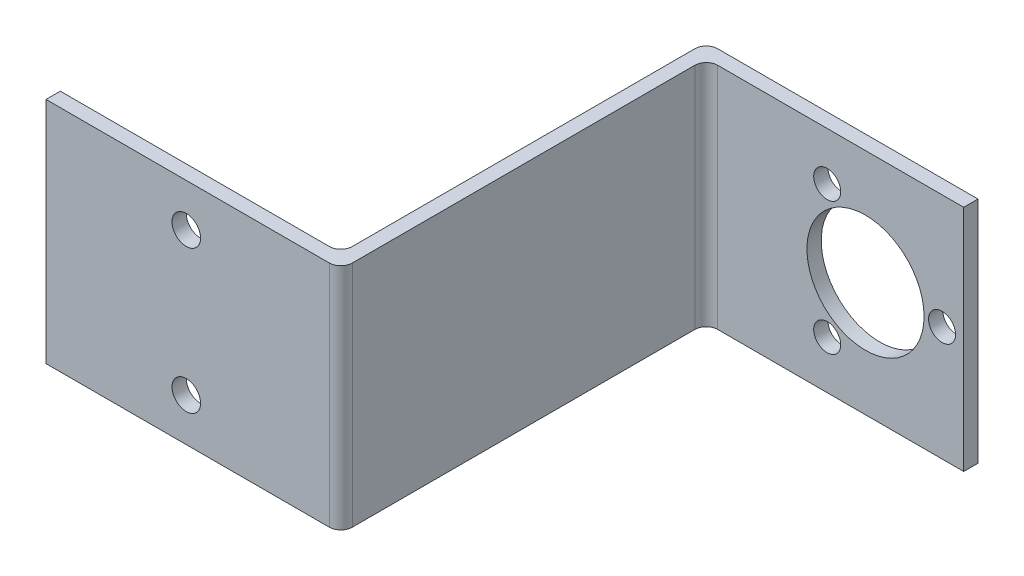
from build123d import *

# Parameters (mm, degrees)
BOSS_EXTRUDE2_DEPTH          = 25.4
CUT_EXTRUDE1_DEPTH           = 945.645794553
F_1_8_0_125_DIAMETER_HOLE1_D = 3.175
FILLET1_R                    = 1.27


with BuildPart() as part:
    # Sketch2 → Boss-Extrude2 (new body)
    with BuildSketch(Plane(origin=(0, 0, 0), x_dir=(1, 0, 0), z_dir=(0, 1, 0))):
        Polygon((-882.132668906, -41.925710249), (-912.295168906, -41.925710249), (-912.295168906, -82.488210249), (-943.432668907, -82.488210249), (-943.432668907, -84.075710249), (-910.707668906, -84.075710249), (-910.707668906, -43.513210249), (-882.132668906, -43.513210249), align=None)
    extrude(amount=BOSS_EXTRUDE2_DEPTH)

    # Sketch3 → Cut-Extrude1 (cut, through all)
    with BuildSketch(Plane.XY.offset(43.513210249)):
        with BuildLine():
            ThreePointArc((-886.032668907, 12.7), (-884.532668907, 11.2), (-883.032668907, 12.7))
            ThreePointArc((-883.032668907, 12.7), (-884.532668907, 14.2), (-886.032668907, 12.7))
        make_face()
        with BuildLine():
            ThreePointArc((-896.532668907, 18.762177827), (-895.983630801, 20.811215932), (-898.032668907, 21.360254038))
            ThreePointArc((-898.032668907, 21.360254038), (-898.581707013, 19.311215932), (-896.532668907, 18.762177827))
        make_face()
        with BuildLine():
            ThreePointArc((-898.032668907, 4.039745962), (-895.983630801, 4.588784068), (-896.532668907, 6.637822174))
            ThreePointArc((-896.532668907, 6.637822174), (-898.581707013, 6.088784068), (-898.032668907, 4.039745962))
        make_face()
        with BuildLine():
            ThreePointArc((-899.532668907, 12.7), (-893.032668907, 6.2), (-886.532668907, 12.7))
            ThreePointArc((-886.532668907, 12.7), (-893.032668907, 19.2), (-899.532668907, 12.7))
        make_face()
    extrude(amount=-CUT_EXTRUDE1_DEPTH, mode=Mode.SUBTRACT)

    # 1/8 (0.125) Diameter Hole1 (through all)
    with Locations(Plane(origin=(0, 0, 82.488210249), x_dir=(-1, 0, 0), z_dir=(0, 0, -1))):
        with Locations((927.863918906, 4.7625), (927.863918906, 20.6375)):
            Hole(F_1_8_0_125_DIAMETER_HOLE1_D / 2)

    # Fillet1
    fillet1_edges = [part.edges().sort_by_distance(p)[0] for p in [
        (-912.295168906, 12.7, 82.488210249),
        (-910.707668906, 12.7, 43.513210249),
        (-912.295168906, 12.7, 41.925710249),
        (-910.707668906, 12.7, 84.075710249),
    ]]
    fillet(fillet1_edges, radius=FILLET1_R)


solid = part.part
